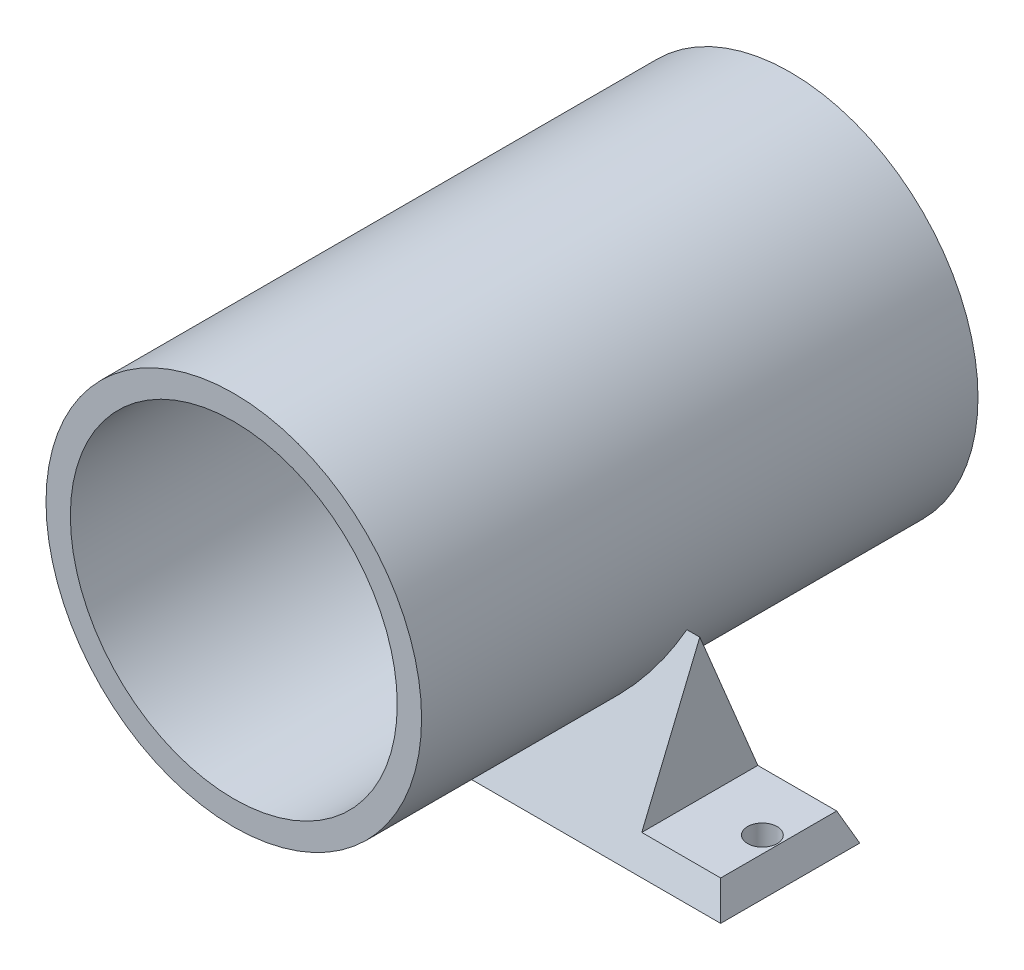
from build123d import *

# Parameters (mm, degrees)
SKETCH1_R               = 42.8625
SKETCH1_R_2             = 37.30625
BOSS_EXTRUDE1_DEPTH     = 63.5
BOSS_EXTRUDE2_START     = 34.23763648
BOSS_EXTRUDE2_DEPTH     = 13.38736352
BOSS_EXTRUDE2_START_2   = -47.625
BOSS_EXTRUDE2_2_DEPTH   = 4.7624999
BOSS_EXTRUDE2_START_3   = -63.5
BOSS_EXTRUDE2_3_DEPTH   = 127
BOSS_EXTRUDE2_START_4   = -63.5000001
BOSS_EXTRUDE2_4_DEPTH   = 127.0000002
SKETCH3_W               = 20.6375
SKETCH3_H               = 31.75
CUT_EXTRUDE1_DEPTH      = 128.485244907
F_1_4_CLEARANCE_HOLE1_D = 6.7564


with BuildPart() as part:
    # Sketch1 → Boss-Extrude1 (new, symmetric)
    with BuildSketch(Plane.XY):
        Circle(SKETCH1_R)
        Circle(SKETCH1_R_2, mode=Mode.SUBTRACT)
    extrude(amount=BOSS_EXTRUDE1_DEPTH, both=True)

    # Boss-Extrude2: read off the stored shape, not the designer's step
    # Boss-Extrude2 outline → Boss-Extrude2 (add)
    with BuildSketch(Plane.YZ.offset(BOSS_EXTRUDE2_START)):
        Polygon((-53.975, 15.875), (-53.975, -15.875), (-15.649359697, 0), align=None)
    extrude(amount=BOSS_EXTRUDE2_DEPTH)



with BuildPart() as body_2:
    # Boss-Extrude2 2 outline → Boss-Extrude2 2 (new body)
    with BuildSketch(Plane.YZ.offset(BOSS_EXTRUDE2_START_2)):
        Polygon((-53.975, 15.875), (-53.975, -15.875), (-15.649359697, 0), align=None)
    extrude(amount=BOSS_EXTRUDE2_2_DEPTH)


with BuildPart() as part_1:
    add(part.part)

    add(body_2.part)  # Boss-Extrude2 3 merges body 2
    # Boss-Extrude2 3 outline → Boss-Extrude2 3 (add)
    with BuildSketch(Plane.YZ.offset(BOSS_EXTRUDE2_START_3)):
        Polygon((-53.975, 15.875), (-53.975, -15.875), (-15.649359697, 0), align=None)
    extrude(amount=BOSS_EXTRUDE2_3_DEPTH)

    # Boss-Extrude2 4 outline → Boss-Extrude2 4 (cut)
    with BuildSketch(Plane.XY.offset(BOSS_EXTRUDE2_START_4)):
        with BuildLine():
            Line((34.57970921, -14), (-34.57970921, -14))
            ThreePointArc((-34.57970921, -14), (0, -37.30625), (34.57970921, -14))
        make_face()
        Polygon((-47.625, -15.649359697), (-46.941812844, -14), (-63.5, -14), (-63.5, -53.975), align=None)
        Polygon((63.5, -14), (46.941812844, -14), (47.625, -15.649359697), (63.5, -53.975), align=None)
    extrude(amount=BOSS_EXTRUDE2_4_DEPTH, mode=Mode.SUBTRACT)

    # Sketch3 → Cut-Extrude1 (cut, through all)
    with BuildSketch(Plane(origin=(0, -47.625, 0), x_dir=(1, 0, 0), z_dir=(0, 1, 0))):
        with Locations((-53.18125, 0)):
            Rectangle(SKETCH3_W, SKETCH3_H)
        with Locations((53.18125, 0)):
            Rectangle(SKETCH3_W, SKETCH3_H)
    extrude(amount=CUT_EXTRUDE1_DEPTH, mode=Mode.SUBTRACT)

    # 1/4 Clearance Hole1 (through all)
    with Locations(Plane(origin=(0, -47.625, 0), x_dir=(1, 0, 0), z_dir=(0, 1, 0))):
        with Locations((-57.15, 0), (57.15, 0)):
            Hole(F_1_4_CLEARANCE_HOLE1_D / 2)


solid = part_1.part
